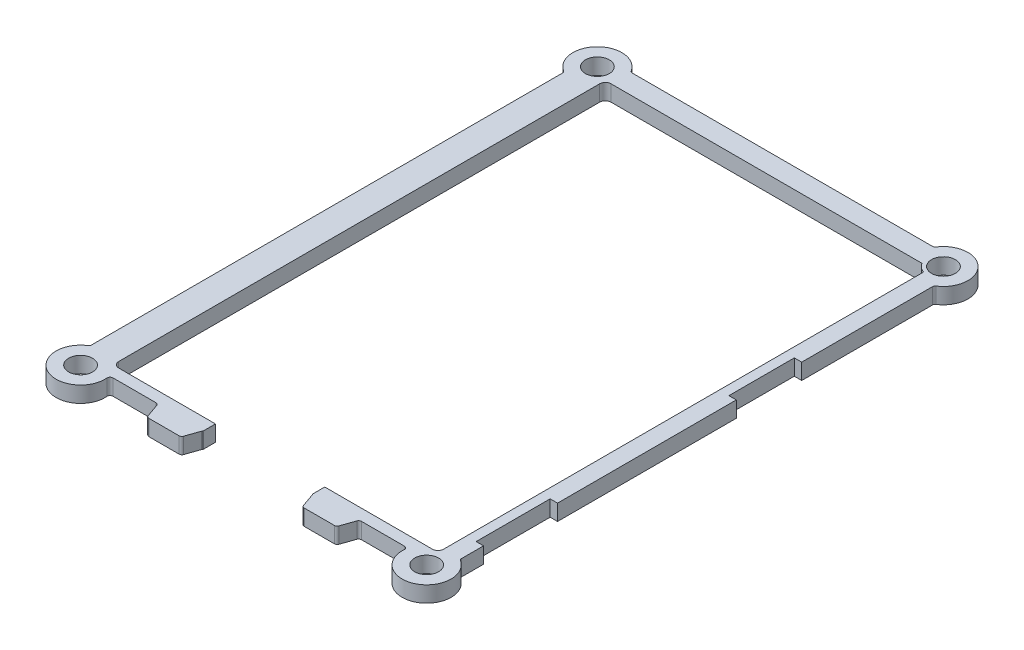
from build123d import *

# Parameters (mm, degrees)
BASEPLATE_OUTLINE_R = 2.1
BASEPLATE_DEPTH     = 2.8
CUT_EXTRUDE1_REACH  = 115.438
FILLET1_R           = 1
CUT_EXTRUDE2_REACH  = 115.438
SKETCH4_W           = 1.3
SKETCH4_H           = 11.5
SKETCH4_H_2         = 13
BOSS_EXTRUDE1_START = -2.8
BOSS_EXTRUDE1_DEPTH = 2.8


# Read off the part's stored shape, not the designer's step: BasePlate
with BuildPart() as part:
    # BasePlate outline → BasePlate (new body)
    with BuildSketch(Plane(origin=(0, 0, 0), x_dir=(1, 0, 0), z_dir=(0, 1, 0))):
        with BuildLine():
            Line((43.502626614, -5.852332608), (48.792614178, -5.852332608))
            ThreePointArc((48.792614178, -5.852332608), (49.082078508, -5.760021707), (49.264659986, -5.517174213))
            Line((49.264659986, -5.517174213), (50.078201202, -3.187491002))
            ThreePointArc((50.078201202, -3.187491002), (50.26078268, -2.944643509), (50.55024701, -2.852332608))
            Line((50.55024701, -2.852332608), (58.116695703, -2.852332608))
            ThreePointArc((58.116695703, -2.852332608), (58.484685739, -3.013831008), (58.614956567, -3.393999275))
            ThreePointArc((58.614956567, -3.393999275), (64.799237397, -7.61016844), (65.229166667, -0.137781095))
            ThreePointArc((65.229166667, -0.137781095), (65.061014427, 0.043158816), (65, 0.282515593))
            Line((65, 0.282515593), (65, 83.012819192))
            ThreePointArc((65, 83.012819192), (65.061014427, 83.252175969), (65.229166667, 83.433115879))
            ThreePointArc((65.229166667, 83.433115879), (65.940559159, 90.088226551), (59.285448487, 89.376834059))
            ThreePointArc((59.285448487, 89.376834059), (59.104508577, 89.208681819), (58.8651518, 89.147667392))
            Line((58.8651518, 89.147667392), (6.1348482, 89.147667392))
            ThreePointArc((6.1348482, 89.147667392), (5.895491423, 89.208681819), (5.714551513, 89.376834059))
            ThreePointArc((5.714551513, 89.376834059), (-0.940559159, 90.088226551), (-0.229166667, 83.433115879))
            ThreePointArc((-0.229166667, 83.433115879), (-0.061014427, 83.252175969), (0, 83.012819192))
            Line((0, 83.012819192), (0, 0.282515593))
            ThreePointArc((0, 0.282515593), (-0.061014427, 0.043158816), (-0.229166667, -0.137781095))
            ThreePointArc((-0.229166667, -0.137781095), (0.200762603, -7.61016844), (6.385043433, -3.393999275))
            ThreePointArc((6.385043433, -3.393999275), (6.515314261, -3.013831008), (6.883304297, -2.852332608))
            Line((6.883304297, -2.852332608), (14.44975299, -2.852332608))
            ThreePointArc((14.44975299, -2.852332608), (14.73921732, -2.944643509), (14.921798798, -3.187491002))
            Line((14.921798798, -3.187491002), (15.735340014, -5.517174213))
            ThreePointArc((15.735340014, -5.517174213), (15.917921492, -5.760021707), (16.207385822, -5.852332608))
            Line((16.207385822, -5.852332608), (21.497373386, -5.852332608))
            ThreePointArc((21.497373386, -5.852332608), (21.786837716, -5.760021707), (21.969419194, -5.517174213))
            Line((21.969419194, -5.517174213), (22.78296041, -3.187491002))
            ThreePointArc((22.78296041, -3.187491002), (22.965541888, -2.944643509), (23.255006218, -2.852332608))
            Line((23.255006218, -2.852332608), (41.744993782, -2.852332608))
            ThreePointArc((41.744993782, -2.852332608), (42.034458112, -2.944643509), (42.21703959, -3.187491002))
            Line((42.21703959, -3.187491002), (43.030580806, -5.517174213))
            ThreePointArc((43.030580806, -5.517174213), (43.213162284, -5.760021707), (43.502626614, -5.852332608))
        make_face()
        with Locations((2.1, -3.752332608)):
            Circle(BASEPLATE_OUTLINE_R, mode=Mode.SUBTRACT)
        with Locations((62.9, -3.752332608)):
            Circle(BASEPLATE_OUTLINE_R, mode=Mode.SUBTRACT)
        with Locations((2.1, 87.047667392)):
            Circle(BASEPLATE_OUTLINE_R, mode=Mode.SUBTRACT)
        with Locations((62.9, 87.047667392)):
            Circle(BASEPLATE_OUTLINE_R, mode=Mode.SUBTRACT)
    extrude(amount=BASEPLATE_DEPTH)

    # Sketch3 → Cut-Extrude1 (cut, up to next)
    with BuildSketch(Plane(origin=(0, 2.8, 0), x_dir=(1, 0, 0), z_dir=(0, 1, 0)), mode=Mode.PRIVATE) as cut_extrude1_sk1:
        Polygon((4.9, 85.647667392), (4.9, -0.852332608), (22.9, -0.852332608), (22.9, -3.00023804), (42.1, -3.00023804), (42.1, -0.852332608), (62, -0.852332608), (62, 85.647667392), align=None)
    cut_extrude1_tool1 = extrude(cut_extrude1_sk1.sketch, amount=-CUT_EXTRUDE1_REACH, mode=Mode.PRIVATE) & part.part
    add(cut_extrude1_tool1.solids().sort_by_distance((33.442134, 2.8, -42.030646))[0], mode=Mode.SUBTRACT)

    # Fillet1
    fillet1_edges = [part.edges().sort_by_distance(p)[0] for p in [
        (4.9, 1.4, -85.647667392),
        (62, 1.4, 0.852332608),
        (4.9, 1.4, 0.852332608),
    ]]
    fillet(fillet1_edges, radius=FILLET1_R)

    # Sketch4 → Cut-Extrude2 (cut, up to next)
    with BuildSketch(Plane(origin=(0, 2.8, 0), x_dir=(1, 0, 0), z_dir=(0, 1, 0)), mode=Mode.PRIVATE) as cut_extrude2_sk1:
        with Locations((64.35, 54.297667392)):
            Rectangle(SKETCH4_W, SKETCH4_H)
    cut_extrude2_tool1 = extrude(cut_extrude2_sk1.sketch, amount=-CUT_EXTRUDE2_REACH, mode=Mode.PRIVATE) & part.part
    # Sketch4 → Cut-Extrude2 (cut, up to next)
    with BuildSketch(Plane(origin=(0, 2.8, 0), x_dir=(1, 0, 0), z_dir=(0, 1, 0)), mode=Mode.PRIVATE) as cut_extrude2_sk2:
        with Locations((64.35, 10.647667392)):
            Rectangle(SKETCH4_W, SKETCH4_H_2)
    cut_extrude2_tool2 = extrude(cut_extrude2_sk2.sketch, amount=-CUT_EXTRUDE2_REACH, mode=Mode.PRIVATE) & part.part
    add(cut_extrude2_tool1.solids().sort_by_distance((64.35, 2.8, -54.297667))[0], mode=Mode.SUBTRACT)
    add(cut_extrude2_tool2.solids().sort_by_distance((64.35, 2.8, -10.647667))[0], mode=Mode.SUBTRACT)

    # Sketch5 → Boss-Extrude1 (add)
    with BuildSketch(Plane(origin=(0, 2.8, 0), x_dir=(1, 0, 0), z_dir=(0, 1, 0)).offset(BOSS_EXTRUDE1_START)):
        with BuildLine():
            Line((61.334752416, 85.647667392), (60.536822695, 85.647667392))
            ThreePointArc((60.536822695, 85.647667392), (61.162428481, 84.920356368), (62, 84.45255526))
            Line((62, 84.45255526), (62, 85.150300796))
            ThreePointArc((62, 85.150300796), (61.64254034, 85.365765134), (61.334752416, 85.647667392))
        make_face()
    extrude(amount=BOSS_EXTRUDE1_DEPTH)


solid = part.part
